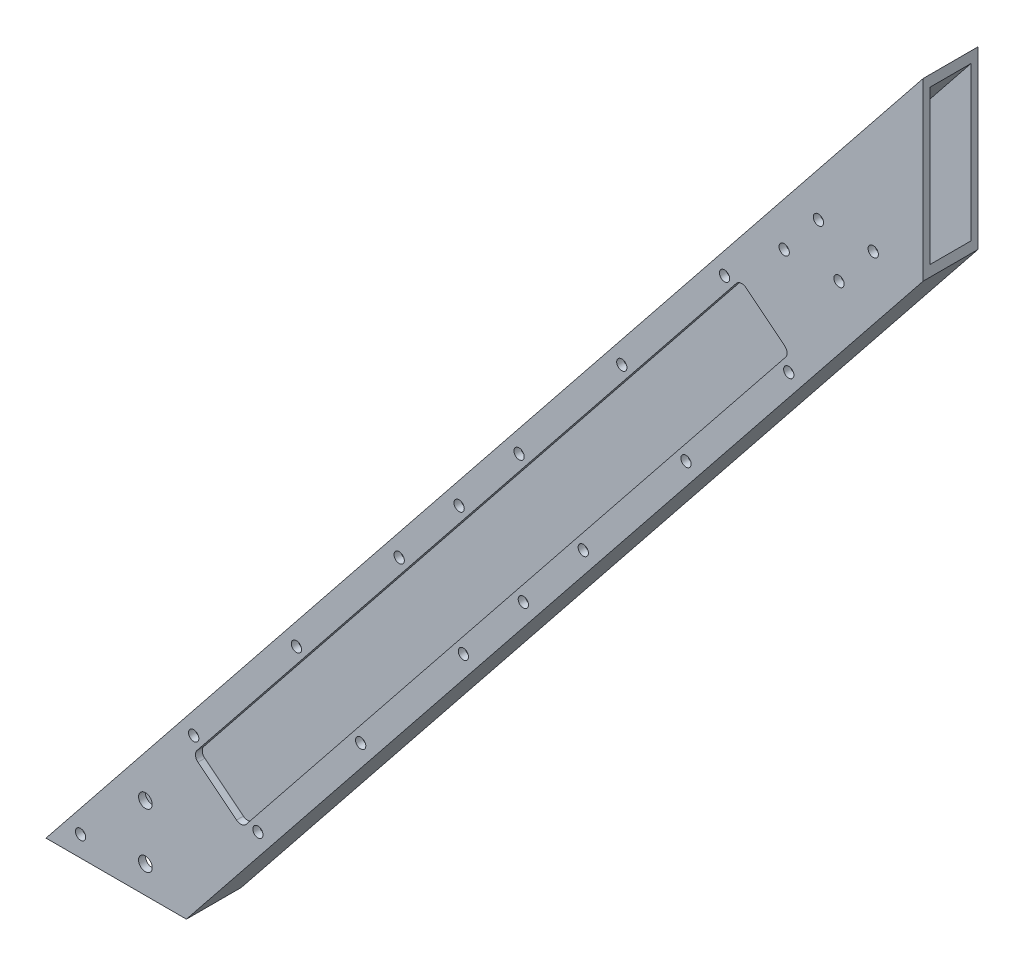
from build123d import *

# Parameters (mm, degrees)
BOSS_EXTRUDE1_DEPTH = 25.4
SHELL1_T            = -3.175
SKETCH2_R           = 2.38125
CUT_EXTRUDE1_DEPTH  = 5.08
FILLET1_R           = 3.175
SKETCH3_R           = 3.175
SKETCH3_R_2         = 2.38125
CUT_EXTRUDE2_DEPTH  = 652.053085393


with BuildPart() as part:
    # Sketch1 → Boss-Extrude1 (new body)
    with BuildSketch(Plane.XY):
        Polygon((0, 0), (406.4, 508), (406.4, 426.680322185), (65.055742252, 0), align=None)
    extrude(amount=BOSS_EXTRUDE1_DEPTH)

    # Shell1
    shell1_openings = [part.faces().sort_by_distance(p)[0] for p in [
        (406.4, 467.340161092, 12.7),
        (32.527871126, 0, 12.7),
    ]]
    offset(amount=SHELL1_T, openings=shell1_openings, kind=Kind.INTERSECTION)

    # Sketch2 → Cut-Extrude1 (cut)
    with BuildSketch(Plane.XY.offset(25.4)):
        with Locations((68.427533771, 75.369457487)):
            Circle(SKETCH2_R)
        with Locations((116.029296395, 134.871660767)):
            Circle(SKETCH2_R)
        with Locations((163.631059019, 194.373864047)):
            Circle(SKETCH2_R)
        with Locations((193.382160659, 170.572982735)):
            Circle(SKETCH2_R)
        with Locations((145.780398035, 111.070779455)):
            Circle(SKETCH2_R)
        with Locations((98.178635411, 51.568576176)):
            Circle(SKETCH2_R)
        with Locations((344.121075633, 358.996626453)):
            Circle(SKETCH2_R)
        with Locations((296.51931301, 299.494423174)):
            Circle(SKETCH2_R)
        with Locations((248.917550386, 239.992219894)):
            Circle(SKETCH2_R)
        with Locations((219.166448746, 263.793101206)):
            Circle(SKETCH2_R)
        with Locations((266.76821137, 323.295304486)):
            Circle(SKETCH2_R)
        with Locations((314.369973994, 382.797507765)):
            Circle(SKETCH2_R)
        with Locations((191.398753883, 229.083482626)):
            Circle(SKETCH2_R)
        with Locations((221.149855522, 205.282601314)):
            Circle(SKETCH2_R)
        Polygon((90.740860001, 49.386828722), (344.616927327, 366.73191288), (321.807749404, 384.979255219), (67.931682077, 67.634171061), align=None)
    extrude(amount=-CUT_EXTRUDE1_DEPTH, mode=Mode.SUBTRACT)

    # Fillet1
    fillet1_edges = [part.edges().sort_by_distance(p)[0] for p in [
        (321.807749404, 384.979255219, 23.8125),
        (344.616927327, 366.73191288, 23.8125),
        (90.740860001, 49.386828722, 23.8125),
        (67.931682077, 67.634171061, 23.8125),
    ]]
    fillet(fillet1_edges, radius=FILLET1_R)

    # Sketch3 → Cut-Extrude2 (cut, through all)
    with BuildSketch(Plane.XY.offset(25.4)):
        with Locations((46.048122728, 12.7)):
            Circle(SKETCH3_R)
        with Locations((16.002, 9.525)):
            Circle(SKETCH3_R_2)
        with Locations((46.048122728, 38.1)):
            Circle(SKETCH3_R)
        with Locations((341.993535563, 407.162)):
            Circle(SKETCH3_R_2)
        with Locations((357.860789771, 426.99606776)):
            Circle(SKETCH3_R_2)
        with Locations((367.393535563, 407.162)):
            Circle(SKETCH3_R_2)
        with Locations((383.260789771, 426.99606776)):
            Circle(SKETCH3_R_2)
    extrude(amount=-CUT_EXTRUDE2_DEPTH, mode=Mode.SUBTRACT)


solid = part.part
